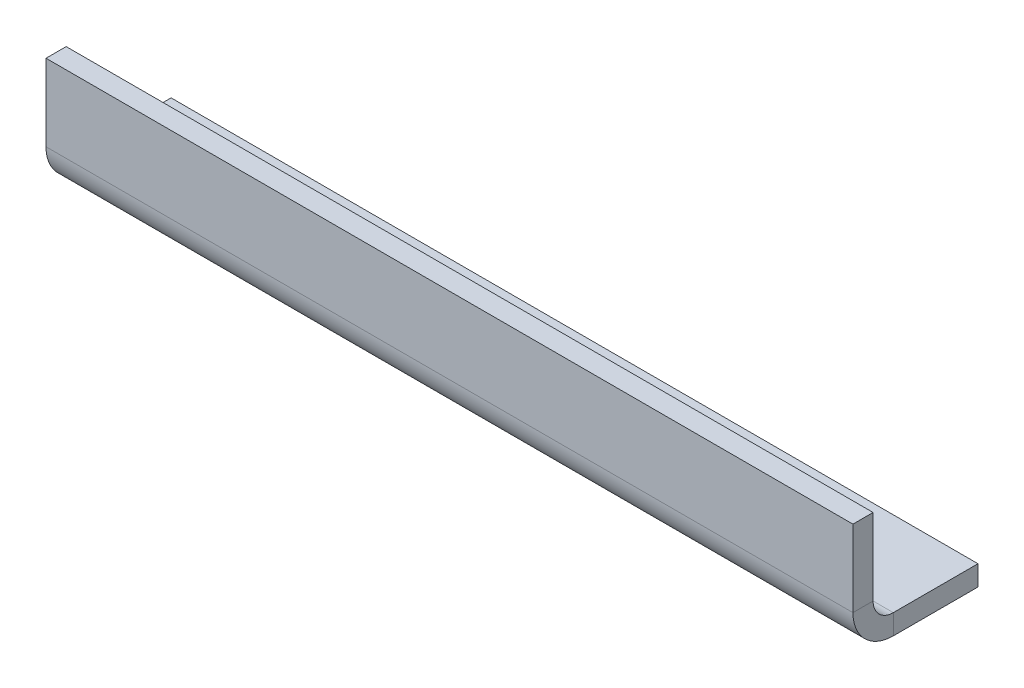
from build123d import *

# Parameters (mm, degrees)
SKETCH1_W                    = 127
SKETCH1_H                    = 15.24
BASE_FLANGE1_DEPTH           = 3.175
EDGE_FLANGE1_STRIP_W         = 20.32
EDGE_FLANGE1_STRIP_H         = 3.175
EDGE_FLANGE1_STRIP_CUT_DEPTH = 127
EDGE_FLANGE1_DEPTH           = 127


# Sheet-metal steps are written as plain solids
with BuildPart() as part:
    # Sketch1 → Base-Flange1 (new body)
    with BuildSketch(Plane(origin=(0, 0, 0), x_dir=(1, 0, 0), z_dir=(0, 1, 0))):
        Rectangle(SKETCH1_W, SKETCH1_H)
    extrude(amount=-BASE_FLANGE1_DEPTH)

    # Edge-Flange1 strip (across the edge) → Edge-Flange1 strip cut (cut)
    with BuildSketch(Plane(origin=(-63.5, 0, 8.89), x_dir=(0, 0, -1), z_dir=(1, 0, 0))):
        with Locations((-6.985, -1.5875)):
            Rectangle(EDGE_FLANGE1_STRIP_W, EDGE_FLANGE1_STRIP_H)
    extrude(amount=EDGE_FLANGE1_STRIP_CUT_DEPTH, mode=Mode.SUBTRACT)

    # Edge-Flange1 section (across the edge) → Edge-Flange1 (add)
    with BuildSketch(Plane(origin=(-63.5, 0, 8.89), x_dir=(0, 0, -1), z_dir=(1, 0, 0))):
        with BuildLine():
            Line((-3.175, 3.175), (-3.175, 15.24))
            Line((-3.175, 15.24), (0, 15.24))
            Line((0, 15.24), (0, 3.175))
            ThreePointArc((0, 3.175), (0.92993597, 0.92993597), (3.175, 0))
            Line((3.175, 0), (3.175, -3.175))
            ThreePointArc((3.175, -3.175), (-1.315128061, -1.315128061), (-3.175, 3.175))
        make_face()
    extrude(amount=EDGE_FLANGE1_DEPTH)


solid = part.part
